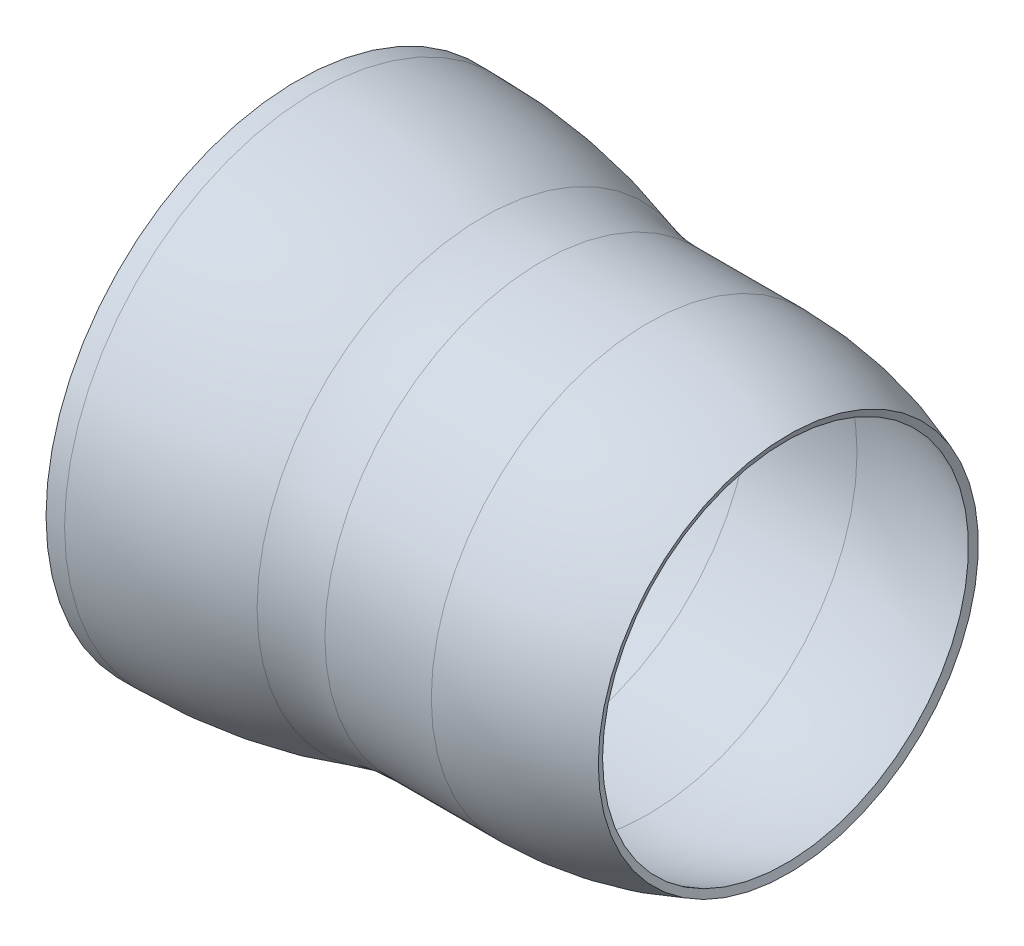
from build123d import *


with BuildPart() as part:
    # Sketch1 → Revolve1 (revolve)
    with BuildSketch(Plane.XY):
        with BuildLine():
            Line((0, 165.5), (0, 160.5))
            Line((0, 160.5), (12.208994244, 160.5))
            ThreePointArc((12.208994244, 160.5), (66.934658879, 156.294181497), (120.375, 143.775506651))
            ThreePointArc((120.375, 143.775506651), (140.199099748, 139.131609294), (160.5, 137.57142903))
            Line((160.5, 137.57142903), (230.5, 137.57142903))
            ThreePointArc((230.5, 137.57142903), (276.559654719, 133.234201023), (321, 120.375))
            Line((321, 120.375), (322.833941607, 125.026522136))
            ThreePointArc((322.833941607, 125.026522136), (277.49303281, 138.146309057), (230.5, 142.57142903))
            Line((230.5, 142.57142903), (160.5, 142.57142903))
            ThreePointArc((160.5, 142.57142903), (140.963114834, 144.072892624), (121.885086003, 148.54201903))
            ThreePointArc((121.885086003, 148.54201903), (67.698673965, 161.235464827), (12.208994244, 165.5))
            Line((12.208994244, 165.5), (0, 165.5))
        make_face()
    revolve(axis=Axis((0, 0, 0), (1, 0, 0)))


solid = part.part
